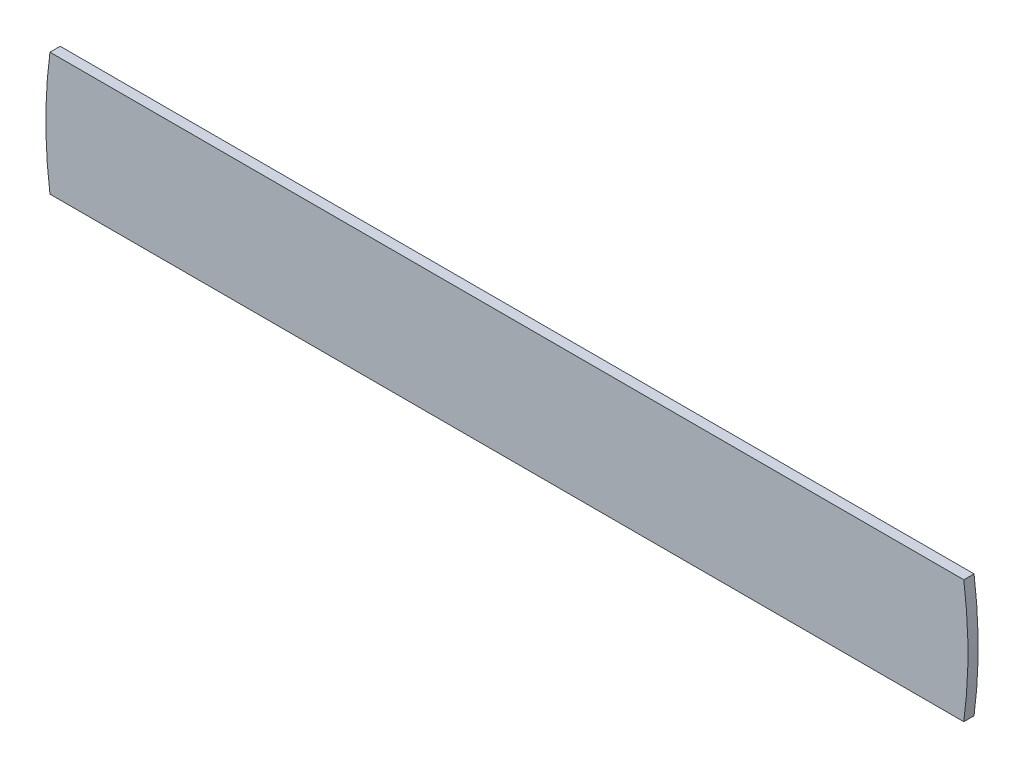
from build123d import *

# Parameters (mm, degrees)
FLANGE_BASE1_DEPTH = 2


# Sheet-metal steps are written as plain solids
with BuildPart() as part:
    # Esboço1 → Flange-base1 (new body)
    with BuildSketch(Plane.XY):
        with BuildLine():
            Line((-89.196412484, 12), (89.196412484, 12))
            ThreePointArc((89.196412484, 12), (90, 0), (89.196412484, -12))
            Line((89.196412484, -12), (-89.196412484, -12))
            ThreePointArc((-89.196412484, -12), (-90, 0), (-89.196412484, 12))
        make_face()
    extrude(amount=-FLANGE_BASE1_DEPTH)


solid = part.part
